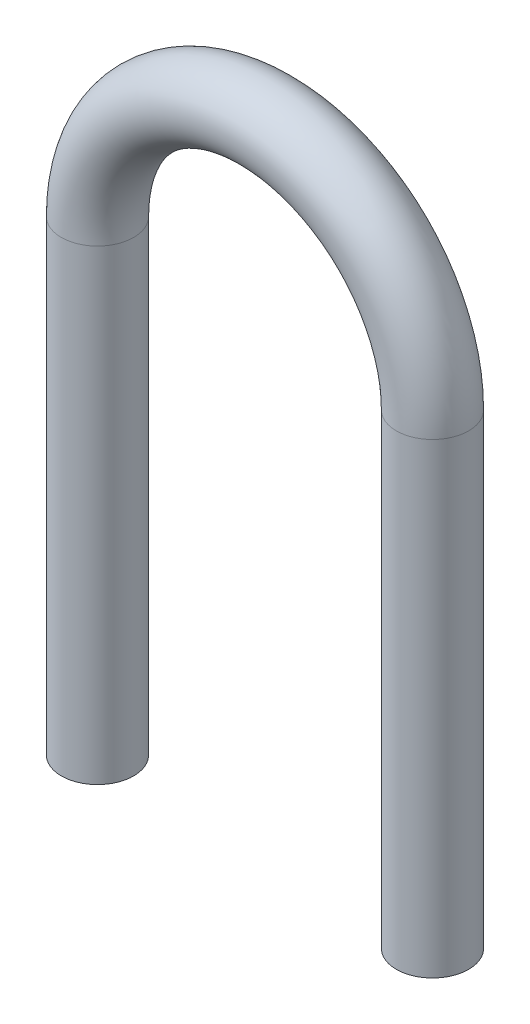
from build123d import *

# Parameters (mm, degrees)
SKETCH2_R = 3


with BuildPart() as part:
    # Sweep1: sweep along a path in Sketch1
    with BuildLine(Plane.XY) as sweep1_path:
        Line((-13.9, -52.6), (-13.9, -13.9))
        ThreePointArc((-13.9, -13.9), (0, 0), (13.9, -13.9))
        Line((13.9, -13.9), (13.9, -52.6))
    # Sketch2 → Sweep1 (sweep)
    with BuildSketch(Plane(origin=(0, -52.6, 0), x_dir=(1, 0, 0), z_dir=(0, 1, 0))):
        with Locations((-13.9, 0)):
            Circle(SKETCH2_R)
    sweep(path=sweep1_path.line)


solid = part.part
